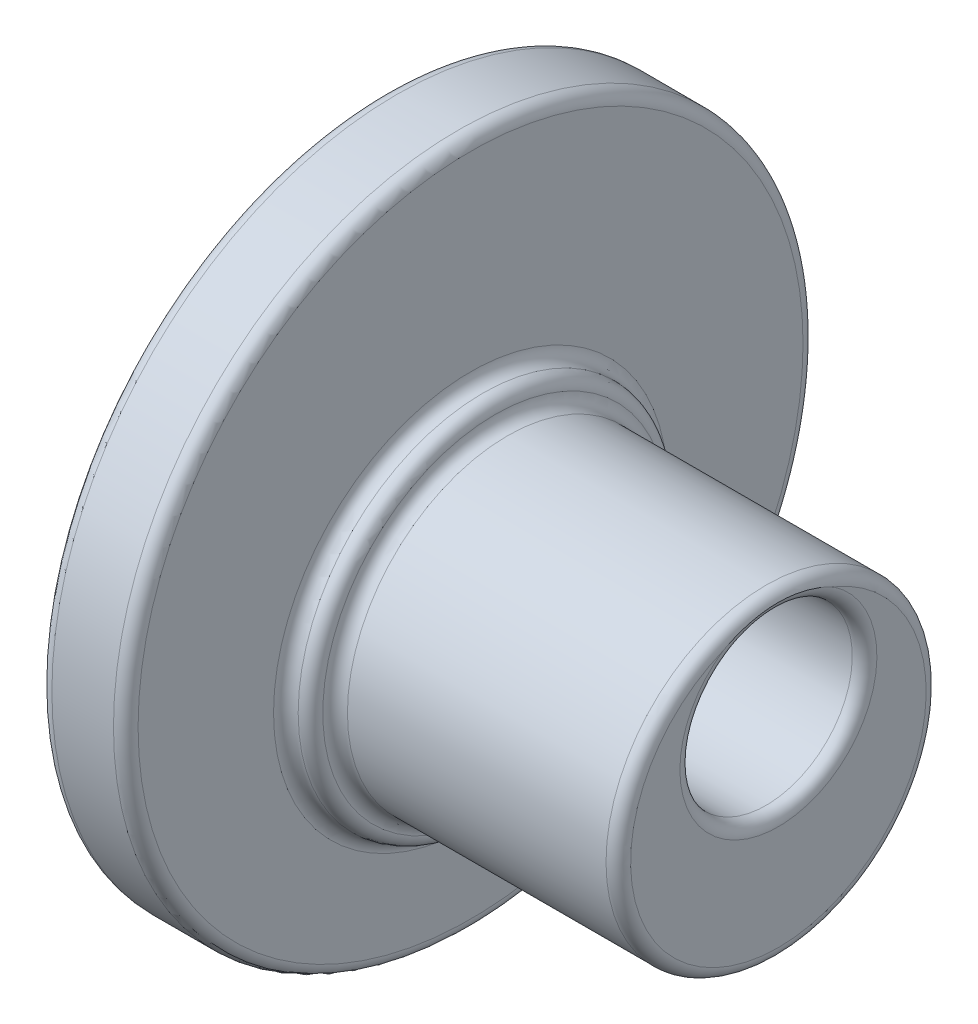
from build123d import *

# Parameters (mm, degrees)
ESQUISSE1_W             = 14
ESQUISSE1_H             = 56
ESQUISSE2_R             = 24.5
ENL_V_MAT_EXTRU_1_DEPTH = 10
ESQUISSE4_R             = 14
ENL_V_MAT_EXTRU_2_DEPTH = 96.854055731
CONG_1_R                = 2


with BuildPart() as part:
    # Esquisse1 → Révolution1 (revolve)
    with BuildSketch(Plane.XY, mode=Mode.PRIVATE) as r_volution1_sk:
        with Locations((7, 28)):
            Rectangle(ESQUISSE1_W, ESQUISSE1_H)
    revolve(r_volution1_sk.sketch.rotate(Axis((0, 0, 0), (1, 0, 0)), 90), axis=Axis((0, 0, 0), (1, 0, 0)))

    # Esquisse2 → Enlèv. mat.-Extru.1 (cut)
    with BuildSketch(Plane.ZY):
        Circle(ESQUISSE2_R)
    extrude(amount=-ENL_V_MAT_EXTRU_1_DEPTH, mode=Mode.SUBTRACT)

    # Esquisse3 → Révolution2 (revolve)
    with BuildSketch(Plane.XY):
        Polygon((14, 21), (18, 21), (18, 17), (60, 17), (64, 17), (64, -9), (14, -9), align=None)
    revolve(axis=Axis((58.599942934, -9, 0), (-1, 0, 0)))

    # Esquisse4 → Enlèv. mat.-Extru.2 (cut, through all)
    with BuildSketch(Plane.ZY.offset(-10)):
        Circle(ESQUISSE4_R)
    extrude(amount=-ENL_V_MAT_EXTRU_2_DEPTH, mode=Mode.SUBTRACT)

    # Congé1
    # the kernel refuses this fillet: 2 mm, written as the material it adds along each edge
    with BuildSketch(Plane(origin=(14, -9, 0), x_dir=(0, 1, 0), z_dir=(0, 0, 1))) as cong_1_piece_1:
        with BuildLine():
            CenterArc((30 + CONG_1_R, -CONG_1_R), CONG_1_R, 90, 90)
            Line((30, -CONG_1_R), (30, 0))
            Line((30, 0), (30 + CONG_1_R, 0))
        make_face()
    revolve(axis=Axis((14, -9, 0), (-1, 0, 0)))
    with BuildSketch(Plane(origin=(18, -9, 0), x_dir=(0, 1, 0), z_dir=(0, 0, 1))) as cong_1_piece_2:
        with BuildLine():
            CenterArc((26 + CONG_1_R, -CONG_1_R), CONG_1_R, 90, 90)
            Line((26, -CONG_1_R), (26, 0))
            Line((26, 0), (26 + CONG_1_R, 0))
        make_face()
    revolve(axis=Axis((18, -9, 0), (-1, 0, 0)))
    with BuildSketch(Plane(origin=(10, 0, 0), x_dir=(0, 0, 1), z_dir=(0, -1, 0))) as cong_1_piece_3:
        with BuildLine():
            CenterArc((24.5 - CONG_1_R, CONG_1_R), CONG_1_R, 270, 90)
            Line((24.5 - CONG_1_R, 0), (24.5, 0))
            Line((24.5, 0), (24.5, CONG_1_R))
        make_face()
    revolve(axis=Axis((10, 0, 0), (-1, 0, 0)))
    # the kernel refuses this fillet: 2 mm, written as the material it takes off along each edge
    with BuildSketch(Plane(origin=(18, -9, 0), x_dir=(0, 1, 0), z_dir=(0, 0, 1))) as cong_1_2_piece_1:
        with BuildLine():
            CenterArc((30 - CONG_1_R, CONG_1_R), CONG_1_R, 270, 90)
            Line((30 - CONG_1_R, 0), (30, 0))
            Line((30, 0), (30, CONG_1_R))
        make_face()
    revolve(axis=Axis((18, -9, 0), (-1, 0, 0)), mode=Mode.SUBTRACT)
    with BuildSketch(Plane(origin=(64, -9, 0), x_dir=(0, 1, 0), z_dir=(0, 0, 1))) as cong_1_2_piece_2:
        with BuildLine():
            CenterArc((26 - CONG_1_R, CONG_1_R), CONG_1_R, 270, 90)
            Line((26, CONG_1_R), (26, 0))
            Line((26, 0), (26 - CONG_1_R, 0))
        make_face()
    revolve(axis=Axis((64, -9, 0), (-1, 0, 0)), mode=Mode.SUBTRACT)
    with BuildSketch(Plane(origin=(64, 0, 0), x_dir=(0, 0, 1), z_dir=(0, -1, 0))) as cong_1_2_piece_3:
        with BuildLine():
            CenterArc((14 + CONG_1_R, CONG_1_R), CONG_1_R, 180, 90)
            Line((14 + CONG_1_R, 0), (14, 0))
            Line((14, 0), (14, CONG_1_R))
        make_face()
    revolve(axis=Axis((64, 0, 0), (-1, 0, 0)), mode=Mode.SUBTRACT)
    with BuildSketch(Plane(origin=(10, 0, 0), x_dir=(0, 0, 1), z_dir=(0, -1, 0))) as cong_1_2_piece_4:
        with BuildLine():
            CenterArc((14 + CONG_1_R, -CONG_1_R), CONG_1_R, 90, 90)
            Line((14, -CONG_1_R), (14, 0))
            Line((14, 0), (14 + CONG_1_R, 0))
        make_face()
    revolve(axis=Axis((10, 0, 0), (-1, 0, 0)), mode=Mode.SUBTRACT)
    with BuildSketch(Plane(origin=(14, 0, 0), x_dir=(0, 0, 1), z_dir=(0, 1, 0))) as cong_1_2_piece_5:
        with BuildLine():
            CenterArc((56 - CONG_1_R, -CONG_1_R), CONG_1_R, 0, 90)
            Line((56 - CONG_1_R, 0), (56, 0))
            Line((56, 0), (56, -CONG_1_R))
        make_face()
    revolve(axis=Axis((14, 0, 0), (1, 0, 0)), mode=Mode.SUBTRACT)
    with BuildSketch(Plane(origin=(0, 0, 0), x_dir=(0, 0, 1), z_dir=(0, 1, 0))) as cong_1_2_piece_6:
        with BuildLine():
            CenterArc((56 - CONG_1_R, CONG_1_R), CONG_1_R, 270, 90)
            Line((56, CONG_1_R), (56, 0))
            Line((56, 0), (56 - CONG_1_R, 0))
        make_face()
    revolve(axis=Axis((0, 0, 0), (1, 0, 0)), mode=Mode.SUBTRACT)
    with BuildSketch(Plane(origin=(0, 0, 0), x_dir=(0, 0, 1), z_dir=(0, -1, 0))) as cong_1_2_piece_7:
        with BuildLine():
            CenterArc((24.5 + CONG_1_R, -CONG_1_R), CONG_1_R, 90, 90)
            Line((24.5, -CONG_1_R), (24.5, 0))
            Line((24.5, 0), (24.5 + CONG_1_R, 0))
        make_face()
    revolve(axis=Axis((0, 0, 0), (-1, 0, 0)), mode=Mode.SUBTRACT)


solid = part.part
